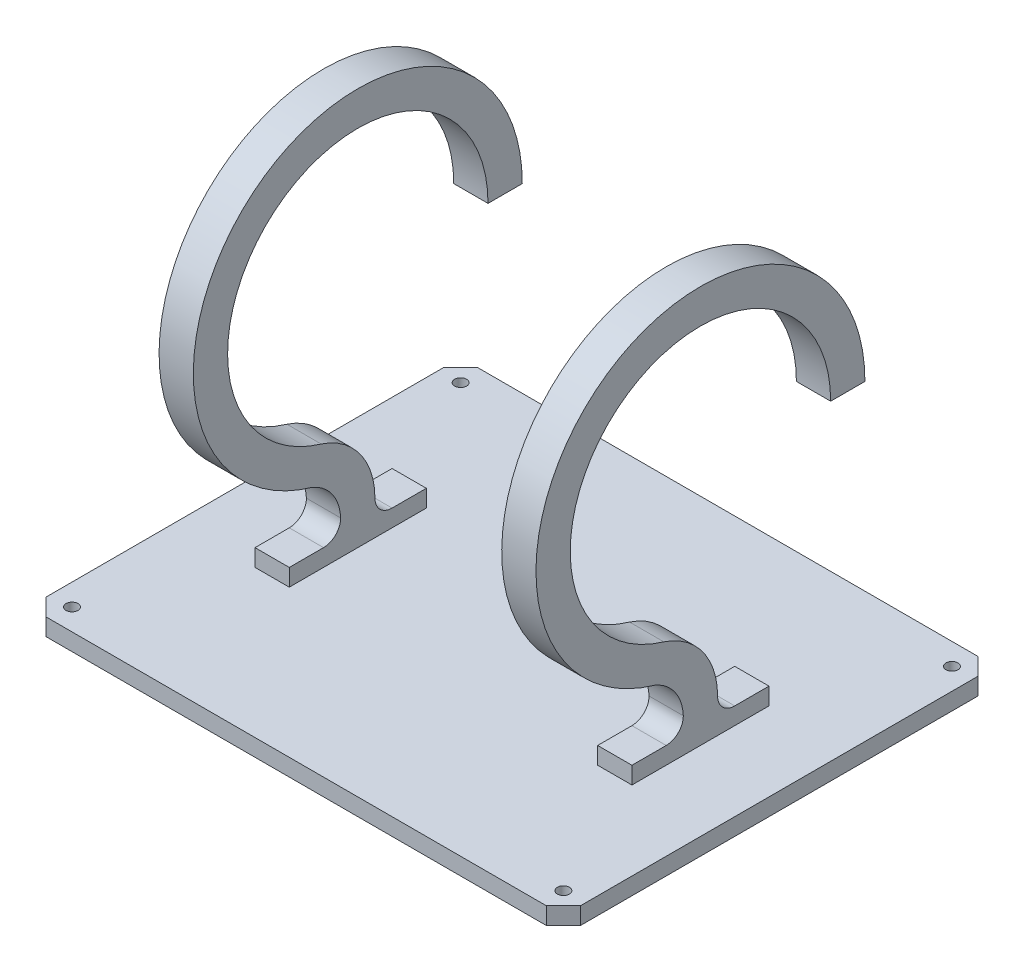
from build123d import *

# Parameters (mm, degrees)
SKETCH1_W                = 156
SKETCH1_H                = 126
BOSS_EXTRUDE1_DEPTH      = 5
CHAMFER1_SIZE            = 5
SKETCH2_R                = 1.75
CUT_EXTRUDE1_DEPTH       = 186.215391696
SKETCH3_W                = 5
SKETCH3_H                = 20
SKETCH3_W_2              = 10
SKETCH3_H_2              = 40
BOSS_EXTRUDE2_DEPTH      = 5
BOSS_EXTRUDE3_DEPTH      = 100
BOSS_EXTRUDE3_DEPTH_BACK = 10
SKETCH6_W                = 5
SKETCH6_H                = 5
SKETCH9_W                = 90
SKETCH9_H                = 28
SKETCH9_H_2              = 40
CUT_EXTRUDE3_DEPTH       = 219.48510549
FILLET1_R                = 5


with BuildPart() as part:
    # Sketch1 → Boss-Extrude1 (new body)
    with BuildSketch(Plane(origin=(0, 0, 0), x_dir=(1, 0, 0), z_dir=(0, 1, 0))):
        with Locations((78, 36.718309859)):
            Rectangle(SKETCH1_W, SKETCH1_H)
    extrude(amount=BOSS_EXTRUDE1_DEPTH)

    # Chamfer1
    chamfer1_edges = [part.edges().sort_by_distance(p)[0] for p in [
        (0, 2.5, -99.718309859),
        (156, 2.5, -99.718309859),
        (156, 2.5, 26.281690141),
        (0, 2.5, 26.281690141),
    ]]
    chamfer(chamfer1_edges, length=CHAMFER1_SIZE)

    # Sketch2 → Cut-Extrude1 (cut, through all)
    with BuildSketch(Plane(origin=(0, 5, 0), x_dir=(1, 0, 0), z_dir=(0, 1, 0))):
        with BuildLine():
            ThreePointArc((8.05, 93.418309859), (7.537436867, 94.655746726), (6.3, 95.168309859))
            Line((6.3, 95.168309859), (6.3, 93.418309859))
            Line((6.3, 93.418309859), (4.55, 93.418309859))
            ThreePointArc((4.55, 93.418309859), (6.3, 91.668309859), (8.05, 93.418309859))
        make_face()
        with BuildLine():
            Line((6.3, 93.418309859), (6.3, 95.168309859))
            ThreePointArc((6.3, 95.168309859), (5.062563133, 94.655746726), (4.55, 93.418309859))
            Line((4.55, 93.418309859), (6.3, 93.418309859))
        make_face()
        with Locations(Location((149.7, -19.981690141, 0), (0, 0, 270))):
            Circle(SKETCH2_R)
        with Locations(Location((149.7, 93.418309859, 0), (0, 0, 270))):
            Circle(SKETCH2_R)
        with Locations(Location((6.3, -19.981690141, 0), (0, 0, 90))):
            Circle(SKETCH2_R)
    extrude(amount=-CUT_EXTRUDE1_DEPTH, mode=Mode.SUBTRACT)

    # Sketch3 → Boss-Extrude2 (add)
    with BuildSketch(Plane(origin=(0, 5, 0), x_dir=(1, 0, 0), z_dir=(0, 1, 0))):
        with Locations((130.5, 46.718309859)):
            Rectangle(SKETCH3_W, SKETCH3_H)
        with Locations((125.5, 46.718309859)):
            Rectangle(SKETCH3_W, SKETCH3_H)
        Polygon((128, 36.718309859), (123, 36.718309859), (123, 16.718309859), (133, 16.718309859), (133, 36.718309859), align=None)
        with Locations((28, 36.718309859)):
            Rectangle(SKETCH3_W_2, SKETCH3_H_2)
    extrude(amount=BOSS_EXTRUDE2_DEPTH)

    # Sketch6 → Boss-Extrude3 (add, two sides: drawn at the far end of the back side and taken through both)
    with BuildSketch(Plane.ZY.offset(-123).offset(-BOSS_EXTRUDE3_DEPTH_BACK)):
        with BuildLine():
            ThreePointArc((-47.881645859, 119.68382942), (-74.400136566, 102.733481734), (-84.718309859, 73))
            Line((-84.718309859, 73), (-74.718309859, 73))
            ThreePointArc((-74.718309859, 73), (-66.480360629, 96.626686903), (-45.338292281, 110.009402901))
            Line((-45.338292281, 110.009402901), (-47.881645859, 119.68382942))
        make_face()
        with BuildLine():
            ThreePointArc((11.281690141, 73), (-6.984828126, 110.681826707), (-47.881645859, 119.68382942))
            Line((-47.881645859, 119.68382942), (-45.338292281, 110.009402901))
            ThreePointArc((-45.338292281, 110.009402901), (-13.091622957, 102.76205077), (1.281690141, 73))
            Line((1.281690141, 73), (11.281690141, 73))
        make_face()
        with BuildLine():
            Line((-26.022614728, 36.536290566), (-26.021811715, 36.53323606))
            Line((-26.021811715, 36.53323606), (-23.47926115, 26.861864046))
            ThreePointArc((-23.47926115, 26.861864046), (1.618841431, 44.116391656), (11.281690141, 73))
            Line((11.281690141, 73), (1.281690141, 73))
            ThreePointArc((1.281690141, 73), (-6.30091011, 50.223218126), (-26.022614728, 36.536290566))
        make_face()
        with BuildLine():
            ThreePointArc((-26.021811715, 36.53323606), (-33.846189614, 32.151003399), (-39.352290573, 25.072323803))
            ThreePointArc((-39.352290573, 25.072323803), (-31.340812266, 25.302174896), (-23.47926115, 26.861864046))
            Line((-23.47926115, 26.861864046), (-26.021811715, 36.53323606))
        make_face()
        with BuildLine():
            ThreePointArc((-39.352290573, 25.072323803), (-41.119015586, 20.173278405), (-41.718309859, 15))
            Line((-41.718309859, 15), (-36.718309859, 15))
            Line((-36.718309859, 15), (-31.718309859, 15))
            ThreePointArc((-31.718309859, 15), (-29.317648494, 22.124824976), (-23.47926115, 26.861864046))
            ThreePointArc((-23.47926115, 26.861864046), (-31.340812266, 25.302174896), (-39.352290573, 25.072323803))
        make_face()
        with Locations((-34.218309859, 12.5)):
            Rectangle(SKETCH6_W, SKETCH6_H)
        with Locations((-39.218309859, 12.5)):
            Rectangle(SKETCH6_W, SKETCH6_H)
    extrude(amount=BOSS_EXTRUDE3_DEPTH + BOSS_EXTRUDE3_DEPTH_BACK)

    # Sketch9 → Cut-Extrude3 (cut, through all)
    with BuildSketch(Plane(origin=(0, 5, 0), x_dir=(1, 0, 0), z_dir=(0, 1, 0))):
        with Locations((78, 70.718309859)):
            Rectangle(SKETCH9_W, SKETCH9_H)
        with Locations((78, 36.718309859)):
            Rectangle(SKETCH9_W, SKETCH9_H_2)
        with Locations((78, 2.718309859)):
            Rectangle(SKETCH9_W, SKETCH9_H)
    extrude(amount=CUT_EXTRUDE3_DEPTH, mode=Mode.SUBTRACT)

    # Fillet1
    fillet1_edges = [part.edges().sort_by_distance(p)[0] for p in [
        (28, 10, -41.718309859),
        (28, 10, -31.718309859),
        (128, 10, -31.718309859),
        (128, 10, -41.718309859),
    ]]
    fillet(fillet1_edges, radius=FILLET1_R - 0.0001)  # a hair under: the kernel refuses the full size


solid = part.part
